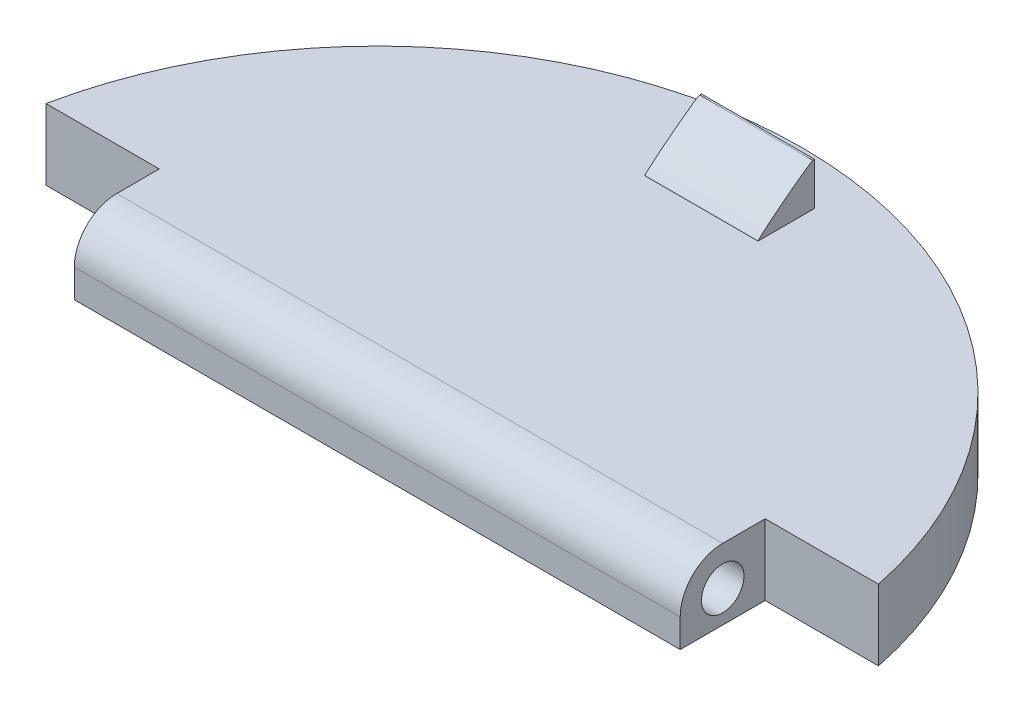
from build123d import *

# Parameters (mm, degrees)
BOSS_EXTRUDE1_DEPTH = 5
SKETCH3_W           = 8
SKETCH3_H           = 4
BOSS_EXTRUDE2_DEPTH = 3
FILLET1_START       = -3.841593316
FILLET1_DEPTH       = 8
CUT_EXTRUDE1_START  = -10
CUT_EXTRUDE1_DEPTH  = 10
FILLET2_R           = 3
SKETCH6_R           = 1.5
CUT_EXTRUDE2_DEPTH  = 5


with BuildPart() as part:
    # Sketch1 → Boss-Extrude1 (new body)
    with BuildSketch(Plane(origin=(0, 0, 0), x_dir=(1, 0, 0), z_dir=(0, 1, 0))):
        with BuildLine():
            Line((-30, 0), (30, 0))
            ThreePointArc((30, 0), (0, 30), (-30, 0))
        make_face()
    extrude(amount=BOSS_EXTRUDE1_DEPTH)

    # Sketch3 → Boss-Extrude2 (add)
    with BuildSketch(Plane(origin=(0, 5, 0), x_dir=(1, 0, 0), z_dir=(0, 1, 0))):
        with Locations((0.158406684, 24.731666579)):
            Rectangle(SKETCH3_W, SKETCH3_H)
    extrude(amount=BOSS_EXTRUDE2_DEPTH)

    # Fillet1: read off the stored shape, not the designer's step
    # Fillet1 outline → Fillet1 (cut)
    with BuildSketch(Plane.YZ.offset(FILLET1_START)):
        with BuildLine():
            Line((8, -22.731666579), (5, -22.731666579))
            add(Edge.make_bspline(
                [(5, -22.731666579), (8, -23.506263249), (8, -26.604649926)],
                knots=[0, 0, 0, 1, 1, 1], degree=2, weights=[1, 0.057495957, 1]))
            Line((8, -26.604649926), (8, -22.731666579))
        make_face()
    extrude(amount=FILLET1_DEPTH, mode=Mode.SUBTRACT)

    # Sketch5 → Cut-Extrude1 (cut)
    with BuildSketch(Plane(origin=(0, 5, 0), x_dir=(1, 0, 0), z_dir=(0, 1, 0)).offset(CUT_EXTRUDE1_START)):
        with BuildLine():
            Line((-21.393876913, 0), (-21.393876913, 6))
            Line((-21.393876913, 6), (-29.393876913, 6))
            ThreePointArc((-29.393876913, 6), (-29.84808459, 3.01526886), (-30, 0))
            Line((-30, 0), (-21.393876913, 0))
        make_face()
        with BuildLine():
            Line((21.393876913, 6), (29.393876913, 6))
            ThreePointArc((29.393876913, 6), (29.84808459, 3.01526886), (30, 0))
            Line((30, 0), (21.393876913, 0))
            Line((21.393876913, 0), (21.393876913, 6))
        make_face()
    extrude(amount=CUT_EXTRUDE1_DEPTH, mode=Mode.SUBTRACT)

    # Fillet2
    fillet2_edges = [part.edges().sort_by_distance(p)[0] for p in [
        (0, 5, 0),
    ]]
    fillet(fillet2_edges, radius=FILLET2_R)

    # Sketch6 → Cut-Extrude2 (cut)
    with BuildSketch(Plane(origin=(21.393876913, 0, 0), x_dir=(0, 0, -1), z_dir=(1, 0, 0))):
        with Locations((3, 2.25)):
            Circle(SKETCH6_R)
    extrude(amount=-CUT_EXTRUDE2_DEPTH, mode=Mode.SUBTRACT)


solid = part.part
